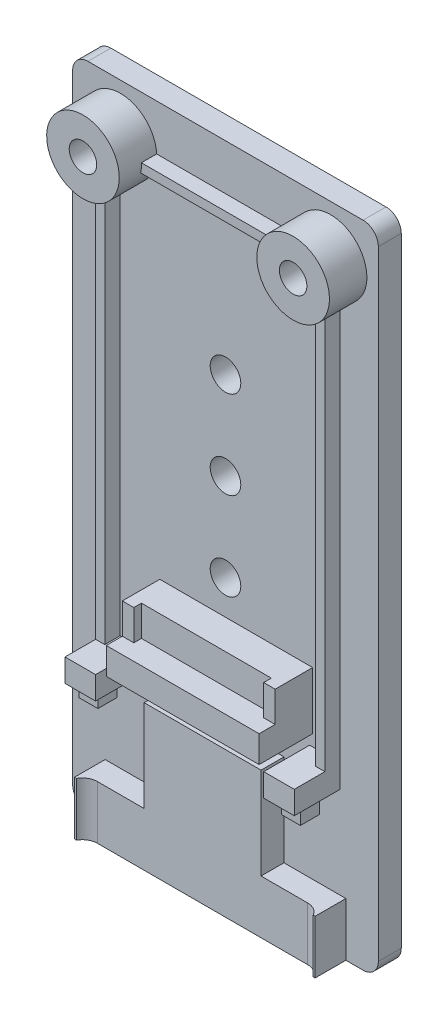
from build123d import *

# Parameters (mm, degrees)
EXTRUDE_1_DEPTH     = 3
SKETCH_4_W          = 31.5
SKETCH_4_H          = 7
EXTRUDE_2_DEPTH     = 3
SKETCH_5_W          = 15.3
SKETCH_5_H          = 12
EXTRUDE_3_DEPTH     = 3
EXTRUDE_3_2_DEPTH   = 2
SKETCH_7_W          = 4
SKETCH_7_H          = 3
EXTRUDE_5_DEPTH     = 6
SKETCH_8_W          = 2.5
SKETCH_8_H          = 2.5
EXTRUDE_6_DEPTH     = 2
EXTRUDE_7_DEPTH     = 7
SKETCH_10_W         = 38.86016461
SKETCH_10_H         = 9.384719245
CUT_EXTRUDE_1_DEPTH = 7
SKETCH_12_W         = 20
SKETCH_12_H         = 4
EXTRUDE_9_DEPTH     = 3.9
SKETCH_13_W         = 1.5
SKETCH_13_H         = 4
EXTRUDE_10_DEPTH    = 1
SKETCH_14_R         = 4.75
EXTRUDE_11_DEPTH    = 4.9
SKETCH_16_R         = 1.8
CUT_EXTRUDE_3_DEPTH = 87.322082101
SKETCH_17_R         = 3.5
CUT_EXTRUDE_4_DEPTH = 4
SKETCH_18_W         = 20
SKETCH_18_H         = 3.5
EXTRUDE_12_DEPTH    = 7
WRAP_START          = -0.4
WRAP_1_OUTLINE_W    = 0.897435898
WRAP_1_OUTLINE_H    = 3.5
WRAP_1_DEPTH        = 0.4
SKETCH_20_R         = 2
CUT_EXTRUDE_5_DEPTH = 7


# Read off the part's stored shape, not the designer's step: Перенос1
with BuildPart() as part:
    # Эскиз3 → Бобышка-Вытянуть1 (new body)
    with BuildSketch(Plane.XY):
        with BuildLine():
            Line((21.251874208, -81.291354299), (21.251874208, -0.291354299))
            ThreePointArc((21.251874208, -0.291354299), (20.66608777, 1.122859264), (19.251874208, 1.708645701))
            Line((19.251874208, 1.708645701), (-16.748125792, 1.708645701))
            ThreePointArc((-16.748125792, 1.708645701), (-18.162339355, 1.122859264), (-18.748125792, -0.291354299))
            Line((-18.748125792, -0.291354299), (-18.748125792, -81.291354299))
            ThreePointArc((-18.748125792, -81.291354299), (-18.162339355, -82.705567861), (-16.748125792, -83.291354299))
            Line((-16.748125792, -83.291354299), (-14.498125792, -83.291354299))
            Line((-14.498125792, -83.291354299), (19.251874208, -83.291354299))
            ThreePointArc((19.251874208, -83.291354299), (20.66608777, -82.705567861), (21.251874208, -81.291354299))
        make_face()
    extrude(amount=EXTRUDE_1_DEPTH)

    # Эскиз4 → Бобышка-Вытянуть2 (add)
    with BuildSketch(Plane.XY.offset(3)):
        with Locations((1.251874208, -79.791354299)):
            Rectangle(SKETCH_4_W, SKETCH_4_H)
    extrude(amount=EXTRUDE_2_DEPTH)

    # Эскиз5 → Extrude 3 (add)
    with BuildSketch(Plane.XY.offset(3)):
        with Locations((1.251874208, -70.291354299)):
            Rectangle(SKETCH_5_W, SKETCH_5_H)
    extrude(amount=EXTRUDE_3_DEPTH)

    # Эскиз6 → Extrude 3 2 (add)
    with BuildSketch(Plane.XY.offset(3)):
        Polygon((-13.748125792, -64.291354299), (-13.748125792, -4.291354299), (16.251874208, -4.291354299), (16.251874208, -64.291354299), (15.051874208, -64.291354299), (15.051874208, -5.491354299), (-12.548125792, -5.491354299), (-12.548125792, -64.291354299), align=None)
    extrude(amount=EXTRUDE_3_2_DEPTH)

    # Эскиз7 → Бобышка-Вытянуть5 (add)
    with BuildSketch(Plane.XY.offset(3)):
        with Locations((-11.748125792, -62.791354299)):
            Rectangle(SKETCH_7_W, SKETCH_7_H)
        with Locations((14.251874208, -62.791354299)):
            Rectangle(SKETCH_7_W, SKETCH_7_H)
    extrude(amount=EXTRUDE_5_DEPTH)

    # Эскиз8 → Бобышка-Вытянуть6 (add)
    with BuildSketch(Plane.XZ.offset(64.291354299)):
        with Locations((-11.998125792, 6.45)):
            Rectangle(SKETCH_8_W, SKETCH_8_H)
        with Locations((14.501874208, 6.45)):
            Rectangle(SKETCH_8_W, SKETCH_8_H)
    extrude(amount=EXTRUDE_6_DEPTH)

    # Эскиз9 → Бобышка-Вытянуть7 (add)
    with BuildSketch(Plane.XZ.offset(83.291354299)):
        with BuildLine():
            Line((-14.498125792, 6), (-14.498125792, 8))
            ThreePointArc((-14.498125792, 8), (-13.912339355, 6.585786438), (-12.498125792, 6))
            Line((-12.498125792, 6), (-14.498125792, 6))
        make_face()
        with BuildLine():
            Line((17.001874208, 6), (15.001874208, 6))
            ThreePointArc((15.001874208, 6), (16.41608777, 6.585786438), (17.001874208, 8))
            Line((17.001874208, 8), (17.001874208, 6))
        make_face()
    extrude(amount=-EXTRUDE_7_DEPTH)

    # Эскиз10 → Вырез-Вытянуть1 (cut)
    with BuildSketch(Plane.XZ.offset(83.291354299)):
        with Locations((0.85139178, 11.707560322)):
            Rectangle(SKETCH_10_W, SKETCH_10_H)
    extrude(amount=-CUT_EXTRUDE_1_DEPTH, mode=Mode.SUBTRACT)

    # Эскиз12 → Бобышка-Вытянуть9 (add)
    with BuildSketch(Plane.XY.offset(3)):
        with Locations((2.651874208, -54.291354299)):
            Rectangle(SKETCH_12_W, SKETCH_12_H)
    extrude(amount=EXTRUDE_9_DEPTH)

    # Эскиз13 → Бобышка-Вытянуть10 (add)
    with BuildSketch(Plane.XY.offset(6.9)):
        with Locations((11.901874208, -54.291354299)):
            Rectangle(SKETCH_13_W, SKETCH_13_H)
        with Locations((-6.598125792, -54.291354299)):
            Rectangle(SKETCH_13_W, SKETCH_13_H)
    extrude(amount=EXTRUDE_10_DEPTH)

    # Эскиз14 → Бобышка-Вытянуть11 (add)
    with BuildSketch(Plane.XY.offset(3)):
        with Locations(Location((-12.498125792, -4.541354299, 0), (0, 0, 254.74247671))):
            Circle(SKETCH_14_R)
        with Locations(Location((15.001874208, -4.541354299, 0), (0, 0, 180))):
            Circle(SKETCH_14_R)
    extrude(amount=EXTRUDE_11_DEPTH)

    # Эскиз16 → Вырез-Вытянуть3 (cut, through all)
    with BuildSketch(Plane.XY.offset(7.9)):
        with Locations((-12.498125792, -4.541354299)):
            Circle(SKETCH_16_R)
        with Locations((15.001874208, -4.541354299)):
            Circle(SKETCH_16_R)
    extrude(amount=-CUT_EXTRUDE_3_DEPTH, mode=Mode.SUBTRACT)

    # Эскиз17 → Вырез-Вытянуть4 (cut)
    with BuildSketch(Plane(origin=(0, 0, 0), x_dir=(-1, 0, 0), z_dir=(0, 0, -1))):
        with Locations((-15.001874208, -4.541354299)):
            Circle(SKETCH_17_R)
        with Locations((12.498125792, -4.541354299)):
            Circle(SKETCH_17_R)
    extrude(amount=-CUT_EXTRUDE_4_DEPTH, mode=Mode.SUBTRACT)

    # Эскиз18 → Бобышка-Вытянуть12 (add)
    with BuildSketch(Plane.XY.offset(3)):
        with Locations((2.651874208, -58.041354299)):
            Rectangle(SKETCH_18_W, SKETCH_18_H)
    extrude(amount=EXTRUDE_12_DEPTH)

    # Перенос1 outline → Перенос1 (cut)
    # profile 1 of 3: a face of its own
    with BuildSketch(Plane.XZ.offset(83.291354299).offset(WRAP_START)):
        with BuildLine():
            add(Edge.make_bspline(
                [(0.971762667, 1.5), (0.908191508, 1.50020437), (0.785468794, 1.500598903), (0.608264135, 1.505416294), (0.444649614, 1.513957561), (0.294722611, 1.524639346), (0.158664341, 1.53946478), (0.03645625, 1.556481913), (-0.071960628, 1.577306359), (-0.167999844, 1.601873952), (-0.25454211, 1.630907486), (-0.335693257, 1.662052171), (-0.411697516, 1.698473839), (-0.482982281, 1.738774368), (-0.549962864, 1.782246677), (-0.61248756, 1.829862159), (-0.670157432, 1.881932528), (-0.722835577, 1.937885814), (-0.769410157, 1.997608324), (-0.811736953, 2.059227105), (-0.845598189, 2.125095846), (-0.875009853, 2.192975425), (-0.896232828, 2.264437317), (-0.912960596, 2.338349293), (-0.921680049, 2.415458372), (-0.923268249, 2.467763964), (-0.924070667, 2.494190705)],
                knots=[0, 0, 0, 0, 0.07918369, 0.15286236, 0.220780569, 0.283251696, 0.340056682, 0.391229738, 0.43690319, 0.477502149, 0.514601086, 0.550550351, 0.585707068, 0.61946814, 0.652491974, 0.685097441, 0.717251441, 0.749173995, 0.780681042, 0.81152345, 0.842124493, 0.872780872, 0.903536606, 0.934827738, 0.967072537, 1, 1, 1, 1], degree=3))
            Line((0.971762667, 1.5), (1.947724205, 1.5))
            Line((1.947724205, 1.5), (1.947724205, 5))
            Line((1.947724205, 5), (1.050288308, 5))
            Line((1.050288308, 5), (1.050288308, 3.474358974))
            add(Edge.make_bspline(
                [(0.069418917, 3.421073718), (0.094152871, 3.425539616), (0.147848874, 3.435234827), (0.236162524, 3.445052875), (0.338085976, 3.454048862), (0.453788762, 3.461811102), (0.583310066, 3.467091734), (0.726583544, 3.471199744), (0.883876329, 3.474201348), (0.993262193, 3.474304959), (1.050288308, 3.474358974)],
                knots=[0, 0, 0, 0, 0.076652669, 0.166408568, 0.270908509, 0.388803477, 0.520106973, 0.666320705, 0.826043028, 1, 1, 1, 1], degree=3))
            add(Edge.make_bspline(
                [(-0.924070667, 2.494190705), (-0.923280696, 2.523447976), (-0.92172475, 2.581073787), (-0.908891016, 2.665504319), (-0.88754852, 2.745952319), (-0.859028443, 2.823199553), (-0.820708483, 2.896003671), (-0.774848335, 2.965653093), (-0.719856568, 3.030626699), (-0.656959752, 3.091877287), (-0.587118568, 3.148850029), (-0.511105436, 3.201910234), (-0.428452264, 3.249016356), (-0.341069552, 3.294000478), (-0.246446443, 3.331679235), (-0.146871093, 3.367282699), (-0.040973258, 3.397360113), (0.032162837, 3.413070651), (0.069418917, 3.421073718)],
                knots=[0, 0, 0, 0, 0.059226347, 0.116653609, 0.172442805, 0.227557458, 0.283016466, 0.338671005, 0.396115815, 0.455017933, 0.516221296, 0.578449912, 0.642494871, 0.708741953, 0.777293663, 0.848541795, 0.922846047, 1, 1, 1, 1], degree=3))
        make_face()
        with BuildLine():
            add(Edge.make_bspline(
                [(0.753713788, 2.846153846), (0.725668551, 2.845962385), (0.671678159, 2.845593799), (0.594071185, 2.844388739), (0.522994219, 2.841702152), (0.458741397, 2.837300055), (0.401160335, 2.832832713), (0.350477252, 2.826253381), (0.306154775, 2.819651451), (0.256859627, 2.80874307), (0.203011209, 2.791242699), (0.145400223, 2.764259758), (0.094231766, 2.732332582), (0.051288186, 2.693476578), (0.016530342, 2.650065849), (-0.008807584, 2.601886118), (-0.023978976, 2.549085389), (-0.025736895, 2.512285503), (-0.026634769, 2.493489583)],
                knots=[0, 0, 0, 0, 0.087984892, 0.169381301, 0.243490732, 0.31108677, 0.371426355, 0.424626274, 0.47139501, 0.511952633, 0.582901013, 0.648499292, 0.711142388, 0.771361583, 0.829301518, 0.884723481, 0.941121333, 1, 1, 1, 1], degree=3))
            Line((0.753713788, 2.846153846), (1.050288308, 2.846153846))
            Line((1.050288308, 2.846153846), (1.050288308, 2.128205128))
            Line((1.050288308, 2.128205128), (0.786666513, 2.128205128))
            add(Edge.make_bspline(
                [(0.193517474, 2.197616186), (0.208149718, 2.191964447), (0.239716749, 2.179771605), (0.292902747, 2.166277432), (0.354490829, 2.154546484), (0.424483924, 2.14495998), (0.502832613, 2.137348407), (0.589808451, 2.131642407), (0.685459838, 2.129351778), (0.752077595, 2.128597013), (0.786666513, 2.128205128)],
                knots=[0, 0, 0, 0, 0.078334475, 0.168995732, 0.273680162, 0.391619348, 0.521902516, 0.667035745, 0.82712007, 1, 1, 1, 1], degree=3))
            add(Edge.make_bspline(
                [(-0.026634769, 2.493489583), (-0.026024796, 2.477059925), (-0.024835011, 2.445012985), (-0.013698376, 2.399015888), (0.002792818, 2.355888178), (0.028346001, 2.317261279), (0.058989424, 2.280836435), (0.097965574, 2.24964819), (0.14221372, 2.219941175), (0.175937076, 2.205266351), (0.193517474, 2.197616186)],
                knots=[0, 0, 0, 0, 0.125011237, 0.243841194, 0.358954674, 0.475083597, 0.595069528, 0.720283665, 0.854180453, 1, 1, 1, 1], degree=3))
        make_face(mode=Mode.SUBTRACT)
    # profile 2 of 3: a face of its own
    with BuildSketch(Plane.XZ.offset(83.291354299).offset(WRAP_START)):
        with BuildLine():
            add(Edge.make_bspline(
                [(4.755716994, 2.397435897), (4.784020824, 2.368917647), (4.83898128, 2.31354083), (4.926267212, 2.240724486), (5.013362574, 2.178233035), (5.101216054, 2.127555756), (5.189405509, 2.087588075), (5.278117479, 2.059519577), (5.367317797, 2.041703865), (5.42707748, 2.039539452), (5.456838788, 2.038461538)],
                knots=[0, 0, 0, 0, 0.148821773, 0.288982531, 0.420667444, 0.545597723, 0.664221049, 0.778709881, 0.889793867, 1, 1, 1, 1], degree=3))
            Line((4.755716994, 2.397435897), (4.101570359, 1.967648237))
            add(Edge.make_bspline(
                [(5.458942154, 1.41025641), (5.400907286, 1.411745056), (5.286036532, 1.414691593), (5.11594271, 1.438068276), (4.949927807, 1.474943986), (4.814746874, 1.518906466), (4.70773641, 1.56294021), (4.625798064, 1.602237704), (4.542173628, 1.648133845), (4.456931276, 1.700044149), (4.369760715, 1.757573029), (4.281444991, 1.821557857), (4.19151339, 1.891847391), (4.132027095, 1.941980363), (4.101570359, 1.967648237)],
                knots=[0, 0, 0, 0, 0.115818089, 0.229243415, 0.342091558, 0.454958989, 0.51248856, 0.573005292, 0.636267093, 0.702838359, 0.77219596, 0.844709553, 0.920491934, 1, 1, 1, 1], degree=3))
            add(Edge.make_bspline(
                [(6.749006256, 2.297876603), (6.748012767, 2.267873023), (6.746046973, 2.208505664), (6.727694994, 2.121181657), (6.698086828, 2.037316444), (6.656921709, 1.95679612), (6.604350228, 1.87941019), (6.539354927, 1.805996884), (6.462881868, 1.735800188), (6.376813617, 1.669051774), (6.281709047, 1.608405989), (6.180128293, 1.555209661), (6.073173961, 1.510193262), (5.960783914, 1.473664146), (5.84314776, 1.444971013), (5.719869145, 1.424727658), (5.591225688, 1.412746232), (5.50360589, 1.411097065), (5.458942154, 1.41025641)],
                knots=[0, 0, 0, 0, 0.052011694, 0.102914283, 0.154092384, 0.205964756, 0.259394338, 0.316010344, 0.37570202, 0.439299716, 0.504774385, 0.571167027, 0.638052053, 0.705895375, 0.776027396, 0.847966533, 0.922501732, 1, 1, 1, 1], degree=3))
            add(Edge.make_bspline(
                [(5.543777891, 3.526241987), (5.60439235, 3.48851699), (5.720704905, 3.416126824), (5.886256433, 3.310111252), (6.034485916, 3.209506282), (6.166165666, 3.11616137), (6.280730119, 3.029150904), (6.378696712, 2.949437684), (6.459933469, 2.876160678), (6.525106866, 2.807540063), (6.578616938, 2.742365612), (6.624269147, 2.679139463), (6.662220455, 2.615339751), (6.694622194, 2.552310878), (6.717956708, 2.488245812), (6.735985284, 2.424855381), (6.746935779, 2.361357029), (6.7483189, 2.318950812), (6.749006256, 2.297876603)],
                knots=[0, 0, 0, 0, 0.11978186, 0.229848361, 0.329790464, 0.42031278, 0.50061585, 0.571102614, 0.632161366, 0.684026302, 0.729711759, 0.773559908, 0.814713146, 0.854167012, 0.892256842, 0.9288816, 0.964656973, 1, 1, 1, 1], degree=3))
            add(Edge.make_bspline(
                [(4.909262667, 4.129907853), (4.91056527, 4.109830378), (4.913250194, 4.068446709), (4.938084095, 4.00792313), (4.975211065, 3.947607146), (5.018015607, 3.898447458), (5.062089064, 3.857494228), (5.105084077, 3.821903128), (5.156782244, 3.782174088), (5.217384071, 3.738853185), (5.286234974, 3.691025697), (5.363935153, 3.639150506), (5.451006373, 3.584078399), (5.511971488, 3.546071006), (5.543777891, 3.526241987)],
                knots=[0, 0, 0, 0, 0.066195889, 0.136442901, 0.213511942, 0.300171859, 0.351060516, 0.41255759, 0.484802944, 0.566802284, 0.659059242, 0.762240449, 0.875957324, 1, 1, 1, 1], degree=3))
            add(Edge.make_bspline(
                [(5.44982757, 4.461538462), (5.413034137, 4.460468214), (5.342191989, 4.458407558), (5.240659523, 4.438672564), (5.147446181, 4.408544433), (5.066140737, 4.364538339), (4.997741887, 4.31411116), (4.947845553, 4.257117088), (4.91496208, 4.195448702), (4.911143812, 4.151540233), (4.909262667, 4.129907853)],
                knots=[0, 0, 0, 0, 0.158963156, 0.306067973, 0.445758512, 0.580973863, 0.704301054, 0.811092378, 0.906930901, 1, 1, 1, 1], degree=3))
            add(Edge.make_bspline(
                [(6.225969397, 4.012820513), (6.197854741, 4.04841865), (6.143399878, 4.117368154), (6.05381237, 4.208831091), (5.96171916, 4.286953288), (5.865809055, 4.350710241), (5.766411792, 4.40026297), (5.66370944, 4.435682506), (5.557790315, 4.457547331), (5.485920689, 4.460204183), (5.44982757, 4.461538462)],
                knots=[0, 0, 0, 0, 0.146075656, 0.282931775, 0.411745189, 0.534552627, 0.653095629, 0.768595453, 0.883788015, 1, 1, 1, 1], degree=3))
            Line((6.225969397, 4.012820513), (6.973365231, 4.344451122))
            add(Edge.make_bspline(
                [(5.45753991, 5.08974359), (5.498687034, 5.089218522), (5.579900301, 5.088182181), (5.699708282, 5.079570616), (5.815566862, 5.065712744), (5.927211308, 5.046055121), (6.035037302, 5.021019175), (6.138547069, 4.98918074), (6.238453059, 4.952923366), (6.334380442, 4.910760567), (6.426181453, 4.862069902), (6.515217248, 4.808245508), (6.599950753, 4.746591106), (6.68242712, 4.67974375), (6.759844452, 4.604621831), (6.8354598, 4.524772741), (6.906992516, 4.437737833), (6.951057907, 4.375804019), (6.973365231, 4.344451122)],
                knots=[0, 0, 0, 0, 0.069915746, 0.137994726, 0.204003451, 0.268121317, 0.330544027, 0.391978547, 0.452035638, 0.511070292, 0.569872046, 0.628516675, 0.687703422, 0.747809079, 0.808764198, 0.870857566, 0.934623929, 1, 1, 1, 1], degree=3))
            add(Edge.make_bspline(
                [(4.011826769, 4.093449519), (4.01296345, 4.128837277), (4.015201053, 4.198499564), (4.035231705, 4.300354161), (4.065366309, 4.397940328), (4.110777409, 4.489793317), (4.167252507, 4.577463939), (4.236268616, 4.660536772), (4.318796338, 4.737832255), (4.412160445, 4.810218734), (4.515891257, 4.875975209), (4.628107211, 4.933398665), (4.748131513, 4.981695294), (4.875238225, 5.022131569), (5.010387482, 5.051347471), (5.152609562, 5.074241056), (5.302570467, 5.087557759), (5.405163627, 5.089004827), (5.45753991, 5.08974359)],
                knots=[0, 0, 0, 0, 0.054294377, 0.106880761, 0.158869658, 0.210720843, 0.263686811, 0.318742268, 0.376121444, 0.437004001, 0.4999343, 0.5644656, 0.630317964, 0.698429304, 0.769050697, 0.842458362, 0.919571194, 1, 1, 1, 1], degree=3))
            add(Edge.make_bspline(
                [(4.506818756, 3.290665064), (4.464720953, 3.323956355), (4.384615198, 3.387304649), (4.278423345, 3.486570299), (4.191747507, 3.583776261), (4.122938613, 3.679554226), (4.072935269, 3.777923067), (4.03748061, 3.87926368), (4.015797748, 3.985024873), (4.013157143, 4.057124645), (4.011826769, 4.093449519)],
                knots=[0, 0, 0, 0, 0.164016378, 0.312098367, 0.443688691, 0.561619719, 0.671529106, 0.779753886, 0.889036923, 1, 1, 1, 1], degree=3))
            add(Edge.make_bspline(
                [(5.12170257, 2.88681891), (5.081503575, 2.912290775), (5.005269385, 2.960596134), (4.897077443, 3.029198518), (4.801574642, 3.091033297), (4.718745124, 3.145461321), (4.647970082, 3.191914187), (4.589811314, 3.231228069), (4.543693029, 3.262836045), (4.517751472, 3.282414142), (4.506818756, 3.290665064)],
                knots=[0, 0, 0, 0, 0.194038191, 0.367977956, 0.522335656, 0.657918667, 0.772091586, 0.867500417, 0.944159856, 1, 1, 1, 1], degree=3))
            add(Edge.make_bspline(
                [(5.772343596, 2.435296474), (5.761240769, 2.445480397), (5.735177711, 2.469386394), (5.687245034, 2.506548982), (5.626000349, 2.551330889), (5.55152297, 2.604055729), (5.463169488, 2.664005245), (5.361693772, 2.732071014), (5.246343431, 2.807136279), (5.164743894, 2.859302686), (5.12170257, 2.88681891)],
                knots=[0, 0, 0, 0, 0.057002562, 0.133809257, 0.229342778, 0.344199144, 0.479135899, 0.633445493, 0.806653426, 1, 1, 1, 1], degree=3))
            add(Edge.make_bspline(
                [(5.851570359, 2.267728365), (5.850590763, 2.282334722), (5.848598291, 2.312043645), (5.83293809, 2.355699045), (5.807094623, 2.397454354), (5.784246657, 2.42233464), (5.772343596, 2.435296474)],
                knots=[0, 0, 0, 0, 0.230074692, 0.467965513, 0.722827033, 1, 1, 1, 1], degree=3))
            add(Edge.make_bspline(
                [(5.456838788, 2.038461538), (5.484482683, 2.039116881), (5.537552779, 2.040374991), (5.613164552, 2.054123697), (5.681388546, 2.075205471), (5.740026111, 2.106134474), (5.788074924, 2.141958019), (5.824932005, 2.180443988), (5.847023465, 2.223403254), (5.850086163, 2.253259773), (5.851570359, 2.267728365)],
                knots=[0, 0, 0, 0, 0.166219856, 0.319104949, 0.461027066, 0.594430909, 0.715980947, 0.820550761, 0.913038162, 1, 1, 1, 1], degree=3))
        make_face()
    # profile 3 of 3: a face of its own
    with BuildSketch(Plane.XZ.offset(83.291354299).offset(WRAP_START)):
        with Locations((-3.34714759, 3.25)):
            Rectangle(WRAP_1_OUTLINE_W, WRAP_1_OUTLINE_H)
    extrude(amount=WRAP_1_DEPTH, mode=Mode.SUBTRACT)

    # Эскиз20 → Вырез-Вытянуть5 (cut)
    with BuildSketch(Plane.XY.offset(3)):
        with Locations((1.251874208, -47.791354299)):
            Circle(SKETCH_20_R)
        with Locations((1.251874208, -36.291354299)):
            Circle(SKETCH_20_R)
        with Locations((1.251874208, -24.791354299)):
            Circle(SKETCH_20_R)
    extrude(amount=-CUT_EXTRUDE_5_DEPTH, mode=Mode.SUBTRACT)


solid = part.part
